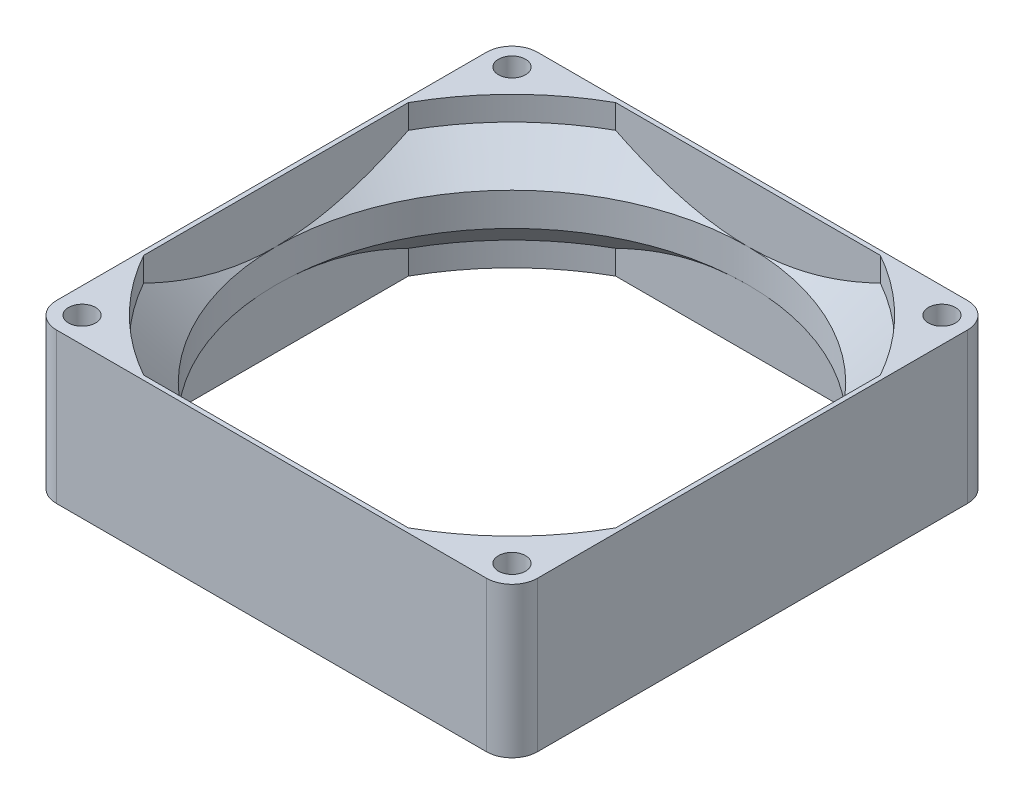
from build123d import *

# Parameters (mm, degrees)
SKETCH1_R               = 2.25
BOSS_EXTRUDE1_DEPTH     = 25
CUT_EXTRUDE1_DEPTH      = 69.373971656
CUT_EXTRUDE1_DEPTH_BACK = 69.373971656


with BuildPart() as part:
    # Sketch1 → Boss-Extrude1 (new body)
    with BuildSketch(Plane(origin=(0, 0, 0), x_dir=(1, 0, 0), z_dir=(0, 1, 0))):
        with BuildLine():
            Line((-35.75, -40), (35.75, -40))
            ThreePointArc((35.75, -40), (38.75520382, -38.75520382), (40, -35.75))
            Line((40, -35.75), (40, 35.75))
            ThreePointArc((40, 35.75), (38.75520382, 38.75520382), (35.75, 40))
            Line((35.75, 40), (-35.75, 40))
            ThreePointArc((-35.75, 40), (-38.75520382, 38.75520382), (-40, 35.75))
            Line((-40, 35.75), (-40, -35.75))
            ThreePointArc((-40, -35.75), (-38.75520382, -38.75520382), (-35.75, -40))
        make_face()
        with Locations((35.75, 35.75)):
            Circle(SKETCH1_R, mode=Mode.SUBTRACT)
        with Locations((35.75, -35.75)):
            Circle(SKETCH1_R, mode=Mode.SUBTRACT)
        with Locations((-35.75, -35.75)):
            Circle(SKETCH1_R, mode=Mode.SUBTRACT)
        with Locations((-35.75, 35.75)):
            Circle(SKETCH1_R, mode=Mode.SUBTRACT)
        with BuildLine():
            Line((22.009940936, 39.25), (-22.009940936, 39.25))
            ThreePointArc((-22.009940936, 39.25), (-31.819805153, 31.819805153), (-39.25, 22.009940936))
            Line((-39.25, 22.009940936), (-39.25, -22.009940936))
            ThreePointArc((-39.25, -22.009940936), (-31.819805153, -31.819805153), (-22.009940936, -39.25))
            Line((-22.009940936, -39.25), (22.009940936, -39.25))
            ThreePointArc((22.009940936, -39.25), (31.819805153, -31.819805153), (39.25, -22.009940936))
            Line((39.25, -22.009940936), (39.25, 22.009940936))
            ThreePointArc((39.25, 22.009940936), (31.819805153, 31.819805153), (22.009940936, 39.25))
        make_face(mode=Mode.SUBTRACT)
    extrude(amount=BOSS_EXTRUDE1_DEPTH)

    # Sketch2 → Revolve1 (revolve)
    with BuildSketch(Plane(origin=(0, 0, 0), x_dir=(0, 0, -1), z_dir=(1, 0, 0))):
        Polygon((45, 21), (39.25, 15.25), (39.25, 9.75), (45, 4), align=None)
    revolve(axis=Axis((0, 0, 0), (0, 1, 0)))

    # Sketch3 → Cut-Extrude1 (cut, two sides: drawn at the far end of the back side and taken through both)
    with BuildSketch(Plane(origin=(0, 0, 0), x_dir=(1, 0, 0), z_dir=(0, 1, 0)).offset(-CUT_EXTRUDE1_DEPTH_BACK)):
        with BuildLine():
            Line((-40, -35.75), (-40, 35.75))
            ThreePointArc((-40, 35.75), (-39.676488013, 37.376404588), (-38.75520382, 38.75520382))
            ThreePointArc((-38.75520382, 38.75520382), (-54.808134855, 0), (-38.75520382, -38.75520382))
            ThreePointArc((-38.75520382, -38.75520382), (-39.676488013, -37.376404588), (-40, -35.75))
        make_face()
        with BuildLine():
            ThreePointArc((38.755203786, 38.755203854), (-2.4e-08, 54.808134855), (-38.75520382, 38.75520382))
            ThreePointArc((-38.75520382, 38.75520382), (-37.376404588, 39.676488013), (-35.75, 40))
            Line((-35.75, 40), (35.75, 40))
            ThreePointArc((35.75, 40), (37.376404566, 39.676488022), (38.755203786, 38.755203854))
        make_face()
        with BuildLine():
            ThreePointArc((-35.75, -40), (-37.376404588, -39.676488013), (-38.75520382, -38.75520382))
            ThreePointArc((-38.75520382, -38.75520382), (6e-09, -54.808134855), (38.755203828, -38.755203812))
            ThreePointArc((38.755203828, -38.755203812), (37.376404593, -39.676488011), (35.75, -40))
            Line((35.75, -40), (-35.75, -40))
        make_face()
        with BuildLine():
            ThreePointArc((38.755203828, -38.755203812), (54.808134855, 2.9e-08), (38.755203786, 38.755203854))
            ThreePointArc((38.755203786, 38.755203854), (39.676488004, 37.376404609), (40, 35.75))
            Line((40, 35.75), (40, -35.75))
            ThreePointArc((40, -35.75), (39.676488015, -37.376404582), (38.755203828, -38.755203812))
        make_face()
    extrude(amount=CUT_EXTRUDE1_DEPTH + CUT_EXTRUDE1_DEPTH_BACK, mode=Mode.SUBTRACT)


solid = part.part
